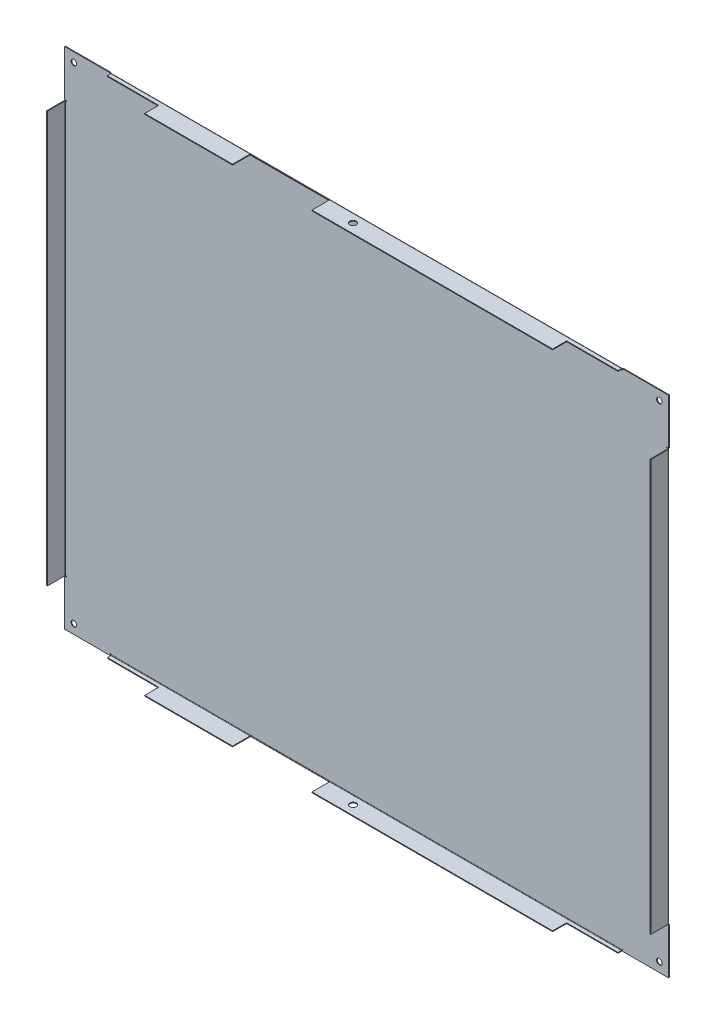
from build123d import *

# Parameters (mm, degrees)
SKETCH_1_W                        = 646.5
SKETCH_1_H                        = 540
SKETCH_1_R                        = 3
SM_BASE_FLANGE_1_DEPTH            = 0.8
SM_EDGE_FLANGE_1_STRIP_W          = 4.2
SM_EDGE_FLANGE_1_STRIP_H          = 0.8
SM_EDGE_FLANGE_1_STRIP_CUT_DEPTH  = 440
SM_EDGE_FLANGE_1_RELIEF_W         = 5
SM_EDGE_FLANGE_1_RELIEF_H         = 0.8
SM_EDGE_FLANGE_1_RELIEF_CUT_DEPTH = 0.8
SM_EDGE_FLANGE_1_DEPTH            = 440
SM_EDGE_FLANGE_2_STRIP_W          = 4.2
SM_EDGE_FLANGE_2_STRIP_H          = 0.8
SM_EDGE_FLANGE_2_STRIP_CUT_DEPTH  = 440
SM_EDGE_FLANGE_2_RELIEF_W         = 5
SM_EDGE_FLANGE_2_RELIEF_H         = 0.8
SM_EDGE_FLANGE_2_RELIEF_CUT_DEPTH = 0.8
SM_EDGE_FLANGE_2_DEPTH            = 440
SM_EDGE_FLANGE_3_STRIP_W          = 4.2
SM_EDGE_FLANGE_3_STRIP_H          = 0.8
SM_EDGE_FLANGE_3_STRIP_CUT_DEPTH  = 546.5
SM_EDGE_FLANGE_3_RELIEF_W         = 5
SM_EDGE_FLANGE_3_RELIEF_H         = 0.8
SM_EDGE_FLANGE_3_RELIEF_CUT_DEPTH = 0.8
SM_EDGE_FLANGE_3_DEPTH            = 546.5
SM_EDGE_FLANGE_3_FLAT_DEPTH       = 0.8
SM_EDGE_FLANGE_4_STRIP_W          = 4.2
SM_EDGE_FLANGE_4_STRIP_H          = 0.8
SM_EDGE_FLANGE_4_STRIP_CUT_DEPTH  = 546.5
SM_EDGE_FLANGE_4_RELIEF_W         = 5
SM_EDGE_FLANGE_4_RELIEF_H         = 0.8
SM_EDGE_FLANGE_4_RELIEF_CUT_DEPTH = 0.8
SM_EDGE_FLANGE_4_DEPTH            = 546.5
SM_EDGE_FLANGE_4_FLAT_DEPTH       = 0.8
SKETCH_18_W                       = 85
SKETCH_18_H                       = 42.323448133
CUT_EXTRUDE_1_DEPTH               = 629.964102712
SKETCH_19_W                       = 85
SKETCH_19_H                       = 50.946353984
CUT_EXTRUDE_2_DEPTH               = 629.964102712
SKETCH_20_R                       = 3.5
CUT_EXTRUDE_3_DEPTH               = 630.650063527


# Sheet-metal steps are written as plain solids
with BuildPart() as part:
    # Sketch 1 → 基体-法兰1 (new body)
    with BuildSketch(Plane.XY):
        Rectangle(SKETCH_1_W, SKETCH_1_H)
        with Locations((313.25, 260)):
            Circle(SKETCH_1_R, mode=Mode.SUBTRACT)
        with Locations((-313.25, 260)):
            Circle(SKETCH_1_R, mode=Mode.SUBTRACT)
        with Locations((-313.25, -260)):
            Circle(SKETCH_1_R, mode=Mode.SUBTRACT)
        with Locations((313.25, -260)):
            Circle(SKETCH_1_R, mode=Mode.SUBTRACT)
    extrude(amount=-SM_BASE_FLANGE_1_DEPTH)

    # 边线-法兰1 strip (across the edge) → 边线-法兰1 strip cut (cut)
    with BuildSketch(Plane(origin=(323.25, -220, 0), x_dir=(-1, 0, 0), z_dir=(0, 1, 0))):
        with Locations((-0.8, -0.4)):
            Rectangle(SM_EDGE_FLANGE_1_STRIP_W, SM_EDGE_FLANGE_1_STRIP_H)
    extrude(amount=SM_EDGE_FLANGE_1_STRIP_CUT_DEPTH, mode=Mode.SUBTRACT)

    # 边线-法兰1 relief (on the sheet) → 边线-法兰1 relief cut (cut)
    with BuildSketch(Plane(origin=(321.95, -220, 0), x_dir=(-1, 0, 0), z_dir=(0, 0, 1))):
        with Locations((-1.7, 0.4)):
            Rectangle(SM_EDGE_FLANGE_1_RELIEF_W, SM_EDGE_FLANGE_1_RELIEF_H)
        with Locations((-1.7, -440.4)):
            Rectangle(SM_EDGE_FLANGE_1_RELIEF_W, SM_EDGE_FLANGE_1_RELIEF_H)
    extrude(amount=-SM_EDGE_FLANGE_1_RELIEF_CUT_DEPTH, mode=Mode.SUBTRACT)

    # 边线-法兰1 section (across the edge) → 边线-法兰1 (add)
    with BuildSketch(Plane(origin=(323.25, -220, 0), x_dir=(-1, 0, 0), z_dir=(0, 1, 0))):
        with BuildLine():
            Line((0, 0.5), (0, 19.2))
            Line((0, 19.2), (0.8, 19.2))
            Line((0.8, 19.2), (0.8, 0.5))
            ThreePointArc((0.8, 0.5), (0.946446609, 0.146446609), (1.3, 0))
            Line((1.3, 0), (1.3, -0.8))
            ThreePointArc((1.3, -0.8), (0.380761184, -0.419238816), (0, 0.5))
        make_face()
    extrude(amount=SM_EDGE_FLANGE_1_DEPTH)

    # 边线-法兰2 strip (across the edge) → 边线-法兰2 strip cut (cut)
    with BuildSketch(Plane(origin=(-323.25, 220, 0), x_dir=(1, 0, 0), z_dir=(0, -1, 0))):
        with Locations((-0.8, -0.4)):
            Rectangle(SM_EDGE_FLANGE_2_STRIP_W, SM_EDGE_FLANGE_2_STRIP_H)
    extrude(amount=SM_EDGE_FLANGE_2_STRIP_CUT_DEPTH, mode=Mode.SUBTRACT)

    # 边线-法兰2 relief (on the sheet) → 边线-法兰2 relief cut (cut)
    with BuildSketch(Plane(origin=(-321.95, 220, 0), x_dir=(1, 0, 0), z_dir=(0, 0, 1))):
        with Locations((-1.7, 0.4)):
            Rectangle(SM_EDGE_FLANGE_2_RELIEF_W, SM_EDGE_FLANGE_2_RELIEF_H)
        with Locations((-1.7, -440.4)):
            Rectangle(SM_EDGE_FLANGE_2_RELIEF_W, SM_EDGE_FLANGE_2_RELIEF_H)
    extrude(amount=-SM_EDGE_FLANGE_2_RELIEF_CUT_DEPTH, mode=Mode.SUBTRACT)

    # 边线-法兰2 section (across the edge) → 边线-法兰2 (add)
    with BuildSketch(Plane(origin=(-323.25, 220, 0), x_dir=(1, 0, 0), z_dir=(0, -1, 0))):
        with BuildLine():
            Line((0, 0.5), (0, 19.2))
            Line((0, 19.2), (0.8, 19.2))
            Line((0.8, 19.2), (0.8, 0.5))
            ThreePointArc((0.8, 0.5), (0.946446609, 0.146446609), (1.3, 0))
            Line((1.3, 0), (1.3, -0.8))
            ThreePointArc((1.3, -0.8), (0.380761184, -0.419238816), (0, 0.5))
        make_face()
    extrude(amount=SM_EDGE_FLANGE_2_DEPTH)

    # 边线-法兰3 strip (across the edge) → 边线-法兰3 strip cut (cut)
    with BuildSketch(Plane(origin=(-273.25, -270, 0), x_dir=(0, 1, 0), z_dir=(1, 0, 0))):
        with Locations((-0.8, -0.4)):
            Rectangle(SM_EDGE_FLANGE_3_STRIP_W, SM_EDGE_FLANGE_3_STRIP_H)
    extrude(amount=SM_EDGE_FLANGE_3_STRIP_CUT_DEPTH, mode=Mode.SUBTRACT)

    # 边线-法兰3 relief (on the sheet) → 边线-法兰3 relief cut (cut)
    with BuildSketch(Plane(origin=(-273.25, -268.7, 0), x_dir=(0, 1, 0), z_dir=(0, 0, 1))):
        with Locations((-1.7, 0.4)):
            Rectangle(SM_EDGE_FLANGE_3_RELIEF_W, SM_EDGE_FLANGE_3_RELIEF_H)
        with Locations((-1.7, -546.9)):
            Rectangle(SM_EDGE_FLANGE_3_RELIEF_W, SM_EDGE_FLANGE_3_RELIEF_H)
    extrude(amount=-SM_EDGE_FLANGE_3_RELIEF_CUT_DEPTH, mode=Mode.SUBTRACT)

    # 边线-法兰3 bend section (across the edge) → 边线-法兰3 (add)
    with BuildSketch(Plane(origin=(-273.25, -270, 0), x_dir=(0, 1, 0), z_dir=(1, 0, 0))):
        with BuildLine():
            Line((0, 0.5), (0.8, 0.5))
            ThreePointArc((0.8, 0.5), (0.946446609, 0.146446609), (1.3, 0))
            Line((1.3, 0), (1.3, -0.8))
            ThreePointArc((1.3, -0.8), (0.380761184, -0.419238816), (0, 0.5))
        make_face()
    extrude(amount=SM_EDGE_FLANGE_3_DEPTH)

    # 边线-法兰3 profile (on flange) → 边线-法兰3 flat (add)
    with BuildSketch(Plane.XZ.offset(270)):
        Polygon((-273.25, 0.5), (273.25, 0.5), (273.25, 4.2), (218.25, 4.2), (218.25, 19.2), (-218.25, 19.2), (-218.25, 4.2), (-273.25, 4.2), align=None)
    extrude(amount=-SM_EDGE_FLANGE_3_FLAT_DEPTH)

    # 边线-法兰4 strip (across the edge) → 边线-法兰4 strip cut (cut)
    with BuildSketch(Plane(origin=(273.25, 270, 0), x_dir=(0, -1, 0), z_dir=(-1, 0, 0))):
        with Locations((-0.8, -0.4)):
            Rectangle(SM_EDGE_FLANGE_4_STRIP_W, SM_EDGE_FLANGE_4_STRIP_H)
    extrude(amount=SM_EDGE_FLANGE_4_STRIP_CUT_DEPTH, mode=Mode.SUBTRACT)

    # 边线-法兰4 relief (on the sheet) → 边线-法兰4 relief cut (cut)
    with BuildSketch(Plane(origin=(273.25, 268.7, 0), x_dir=(0, -1, 0), z_dir=(0, 0, 1))):
        with Locations((-1.7, 0.4)):
            Rectangle(SM_EDGE_FLANGE_4_RELIEF_W, SM_EDGE_FLANGE_4_RELIEF_H)
        with Locations((-1.7, -546.9)):
            Rectangle(SM_EDGE_FLANGE_4_RELIEF_W, SM_EDGE_FLANGE_4_RELIEF_H)
    extrude(amount=-SM_EDGE_FLANGE_4_RELIEF_CUT_DEPTH, mode=Mode.SUBTRACT)

    # 边线-法兰4 bend section (across the edge) → 边线-法兰4 (add)
    with BuildSketch(Plane(origin=(273.25, 270, 0), x_dir=(0, -1, 0), z_dir=(-1, 0, 0))):
        with BuildLine():
            Line((0, 0.5), (0.8, 0.5))
            ThreePointArc((0.8, 0.5), (0.946446609, 0.146446609), (1.3, 0))
            Line((1.3, 0), (1.3, -0.8))
            ThreePointArc((1.3, -0.8), (0.380761184, -0.419238816), (0, 0.5))
        make_face()
    extrude(amount=SM_EDGE_FLANGE_4_DEPTH)

    # 边线-法兰4 profile (on flange) → 边线-法兰4 flat (add)
    with BuildSketch(Plane(origin=(0, 270, 0), x_dir=(-1, 0, 0), z_dir=(0, 1, 0))):
        Polygon((-273.25, 0.5), (273.25, 0.5), (273.25, 4.2), (218.25, 4.2), (218.25, 19.2), (-218.25, 19.2), (-218.25, 4.2), (-273.25, 4.2), align=None)
    extrude(amount=-SM_EDGE_FLANGE_4_FLAT_DEPTH)

    # 草图18 → 切除-拉伸1 (cut, through all)
    with BuildSketch(Plane(origin=(0, -269.2, 0), x_dir=(1, 0, 0), z_dir=(0, 1, 0))):
        with Locations((-81.712681962, -21.161724066)):
            Rectangle(SKETCH_18_W, SKETCH_18_H)
    extrude(amount=-CUT_EXTRUDE_1_DEPTH, mode=Mode.SUBTRACT)

    # 草图19 → 切除-拉伸2 (cut, through all)
    with BuildSketch(Plane.XZ.offset(-269.2)):
        with Locations((-81.712681962, 25.473176992)):
            Rectangle(SKETCH_19_W, SKETCH_19_H)
    extrude(amount=-CUT_EXTRUDE_2_DEPTH, mode=Mode.SUBTRACT)

    # 草图20 → 切除-拉伸3 (cut, through all)
    with BuildSketch(Plane(origin=(0, -270, 0), x_dir=(-1, 0, 0), z_dir=(0, -1, 0))):
        with Locations(Location((5.25, -9.2, 0), (0, 0, 90))):
            Circle(SKETCH_20_R)
    extrude(amount=-CUT_EXTRUDE_3_DEPTH, mode=Mode.SUBTRACT)


solid = part.part
